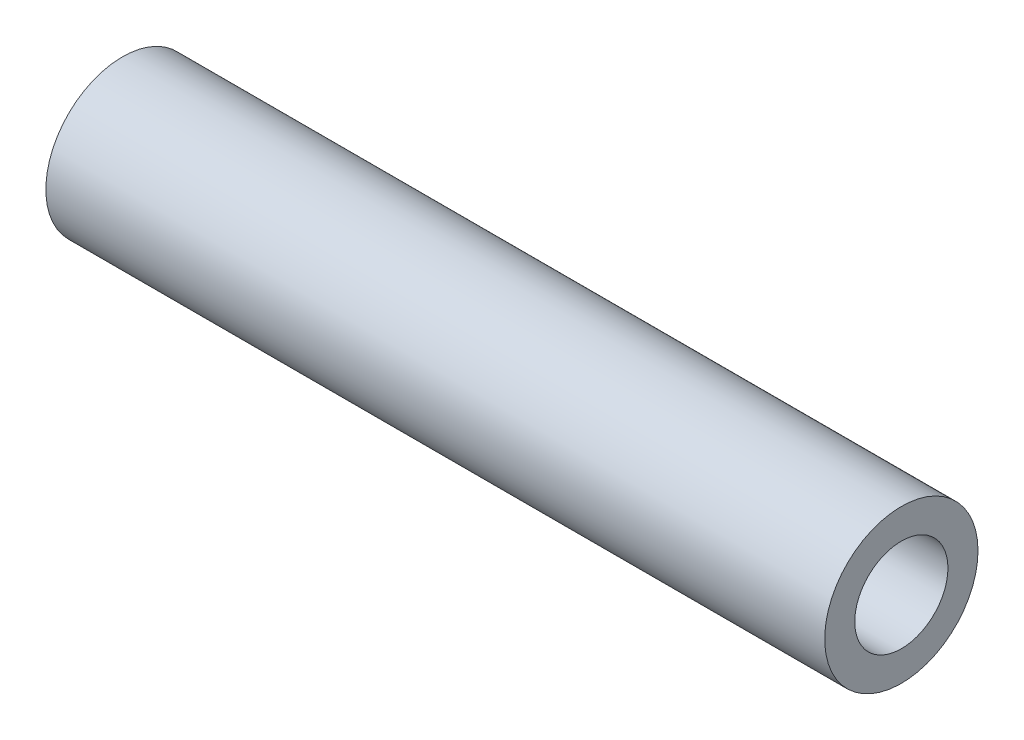
from build123d import *

# Parameters (mm, degrees)
SKETCH1_R           = 3.175
SKETCH1_R_2         = 1.9304
BOSS_EXTRUDE1_DEPTH = 16.129


with BuildPart() as part:
    # Sketch1 → Boss-Extrude1 (new, symmetric)
    with BuildSketch(Plane(origin=(0, 0, 0), x_dir=(0, 0, -1), z_dir=(1, 0, 0))):
        Circle(SKETCH1_R)
        Circle(SKETCH1_R_2, mode=Mode.SUBTRACT)
    extrude(amount=BOSS_EXTRUDE1_DEPTH, both=True)


solid = part.part
